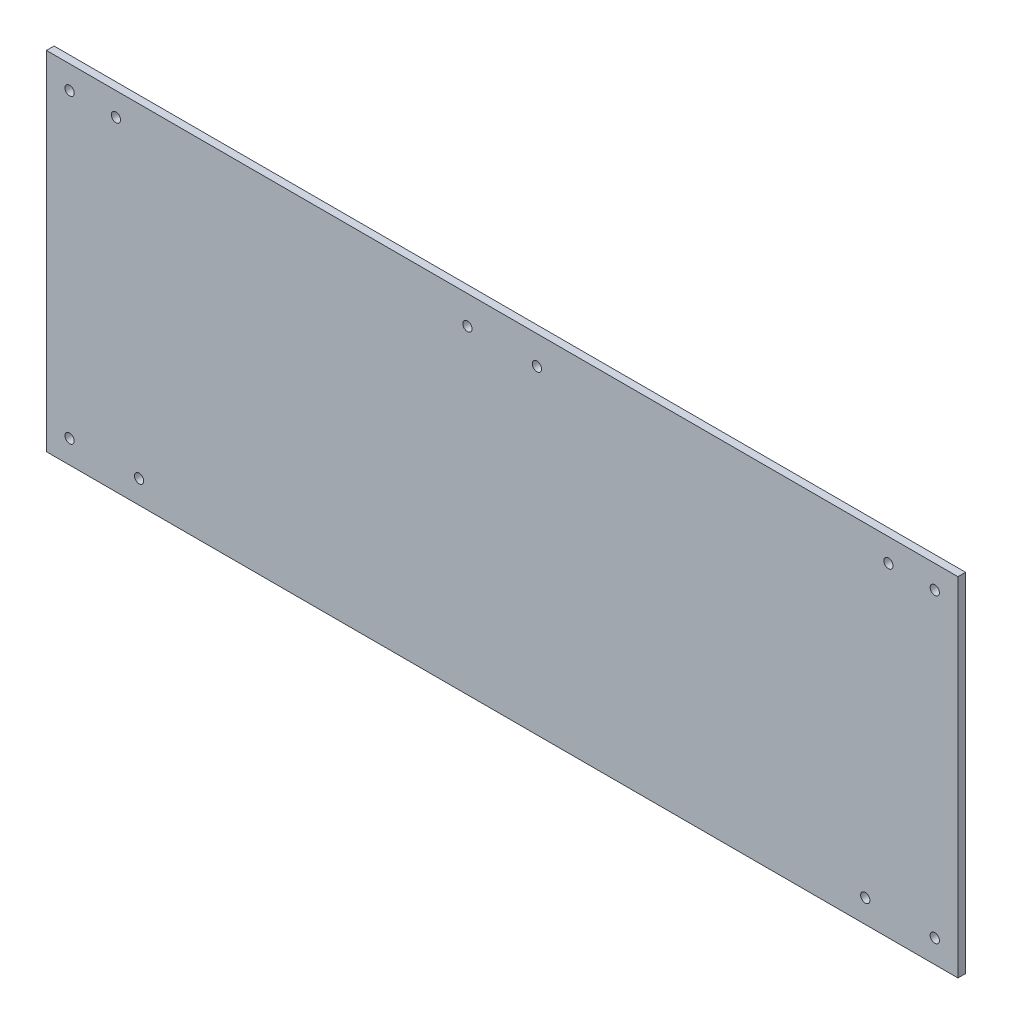
from build123d import *

# Parameters (mm, degrees)
SKETCH1_W           = 393.4
SKETCH1_H           = 150
BOSS_EXTRUDE1_DEPTH = 3.3
SKETCH2_R           = 2
CUT_EXTRUDE1_DEPTH  = 257.520622953
SKETCH3_R           = 2
CUT_EXTRUDE2_DEPTH  = 4
SKETCH4_R           = 2
CUT_EXTRUDE3_DEPTH  = 4


with BuildPart() as part:
    # Sketch1 → Boss-Extrude1 (new body)
    with BuildSketch(Plane.XY):
        with Locations((27, -50.5)):
            Rectangle(SKETCH1_W, SKETCH1_H)
    extrude(amount=BOSS_EXTRUDE1_DEPTH)

    # Sketch2 → Cut-Extrude1 (cut, through all)
    with BuildSketch(Plane(origin=(0, 0, 0), x_dir=(-1, 0, 0), z_dir=(0, 0, -1))):
        with Locations((-183.7, -115.5)):
            Circle(SKETCH2_R)
        with Locations((-213.7, -115.5)):
            Circle(SKETCH2_R)
        with Locations((129.7, -115.5)):
            Circle(SKETCH2_R)
        with Locations((159.7, -115.5)):
            Circle(SKETCH2_R)
    extrude(amount=-CUT_EXTRUDE1_DEPTH, mode=Mode.SUBTRACT)

    # Sketch3 → Cut-Extrude2 (cut)
    with BuildSketch(Plane.XY.offset(3.3)):
        with Locations((-159.7, 14.5)):
            Circle(SKETCH3_R)
        with Locations((-139.7, 14.5)):
            Circle(SKETCH3_R)
        with Locations((193.7, 14.5)):
            Circle(SKETCH3_R)
        with Locations((213.7, 14.5)):
            Circle(SKETCH3_R)
    extrude(amount=-CUT_EXTRUDE2_DEPTH, mode=Mode.SUBTRACT)

    # Sketch4 → Cut-Extrude3 (cut)
    with BuildSketch(Plane.XY.offset(3.3)):
        with Locations((12, 12.25)):
            Circle(SKETCH4_R)
        with Locations((42, 12.25)):
            Circle(SKETCH4_R)
    extrude(amount=-CUT_EXTRUDE3_DEPTH, mode=Mode.SUBTRACT)


solid = part.part
